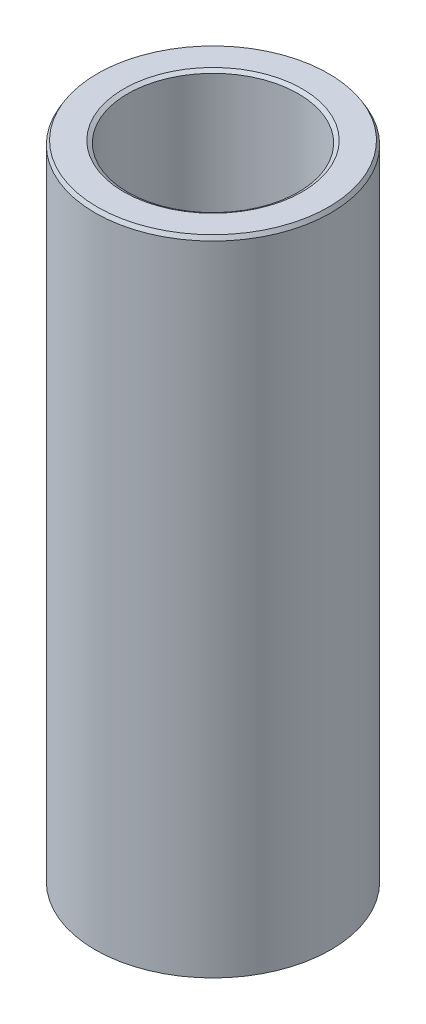
from build123d import *
from OCP.BRepFilletAPI import BRepFilletAPI_MakeChamfer

# Parameters (mm, degrees)
SKETCH1_R           = 45
BOSS_EXTRUDE1_DEPTH = 245.972160094
SKETCH2_R           = 32.574729493
CUT_EXTRUDE1_DEPTH  = 255.071453613
CHAMFER1_SIZE       = 1.50108323
CHAMFER1_SIZE2      = 0.866650807


with BuildPart() as part:
    # Sketch1 → Boss-Extrude1 (new body)
    with BuildSketch(Plane(origin=(0, 0, 0), x_dir=(1, 0, 0), z_dir=(0, 1, 0))):
        Circle(SKETCH1_R)
    extrude(amount=BOSS_EXTRUDE1_DEPTH)

    # Sketch2 → Cut-Extrude1 (cut, through all)
    with BuildSketch(Plane(origin=(0, 0, 0), x_dir=(1, 0, 0), z_dir=(0, 1, 0))):
        Circle(SKETCH2_R)
    extrude(amount=CUT_EXTRUDE1_DEPTH, mode=Mode.SUBTRACT)

    # Chamfer1: one chamfer whose edges measure the first distance from different faces: ONE call of the kernel's chamfer builder (chamfer() names one face for all edges)
    chamfer1_edges_1 = [part.edges().sort_by_distance(p)[0] for p in [
        (-32.574729493, 245.972160094, 0),
    ]]
    chamfer1_side_1 = [part.faces().sort_by_distance(p)[0] for p in [
        (-43.727207794, 245.972160094, 0),
    ]]
    chamfer1_edges_2 = [part.edges().sort_by_distance(p)[0] for p in [
        (-32.574729493, 0, 0),
    ]]
    chamfer1_side_2 = [part.faces().sort_by_distance(p)[0] for p in [
        (-32.574729493, 122.986080047, 0),
    ]]
    chamfer1_edges_3 = [part.edges().sort_by_distance(p)[0] for p in [
        (-45, 0, 0),
    ]]
    chamfer1_side_3 = [part.faces().sort_by_distance(p)[0] for p in [
        (-43.727207794, 0, 0),
    ]]
    chamfer1_edges_4 = [part.edges().sort_by_distance(p)[0] for p in [
        (-45, 245.972160094, 0),
    ]]
    chamfer1_side_4 = [part.faces().sort_by_distance(p)[0] for p in [
        (-45, 122.986080047, 0),
    ]]
    chamfer1 = BRepFilletAPI_MakeChamfer(part.part.solid().wrapped)
    for e in chamfer1_edges_1:
        chamfer1.Add(CHAMFER1_SIZE, CHAMFER1_SIZE2, e.wrapped, chamfer1_side_1[0].wrapped)  # the first distance lies on this face
    for e in chamfer1_edges_2:
        chamfer1.Add(CHAMFER1_SIZE, CHAMFER1_SIZE2, e.wrapped, chamfer1_side_2[0].wrapped)  # the first distance lies on this face
    for e in chamfer1_edges_3:
        chamfer1.Add(CHAMFER1_SIZE, CHAMFER1_SIZE2, e.wrapped, chamfer1_side_3[0].wrapped)  # the first distance lies on this face
    for e in chamfer1_edges_4:
        chamfer1.Add(CHAMFER1_SIZE, CHAMFER1_SIZE2, e.wrapped, chamfer1_side_4[0].wrapped)  # the first distance lies on this face
    add(Compound.cast(chamfer1.Shape()), mode=Mode.REPLACE)


solid = part.part
